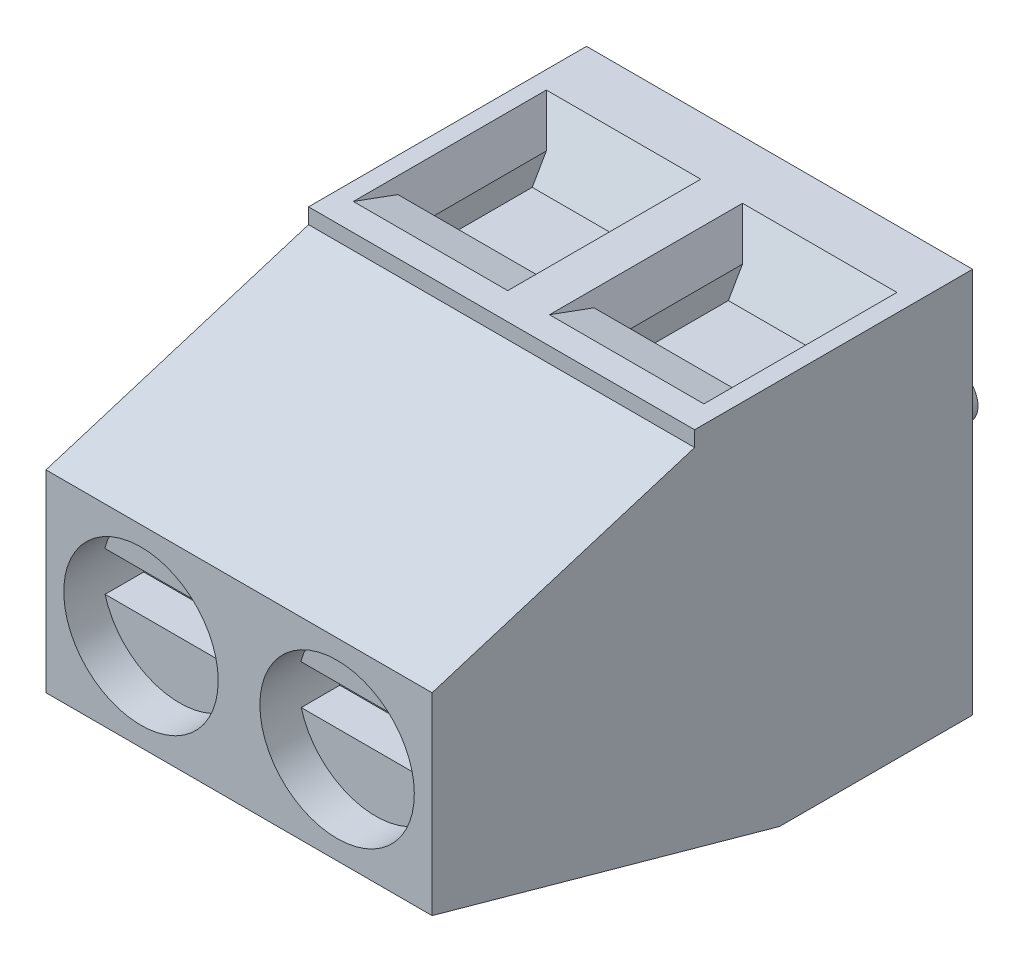
from build123d import *
from build123d.topology import SkipClean

# Parameters (mm, degrees)
SKETCH_1_W          = 10
SKETCH_1_H          = 10
EXTRUDE_1_DEPTH     = 14
CUT_EXTRUDE_1_DEPTH = 20.899748742
SKETCH_3_W          = 3
SKETCH_3_H          = 3
CUT_EXTRUDE_2_DEPTH = 1.5
CHAMFER_1_SIZE      = 1
CHAMFER_1_SIZE2     = 0.267949192
CHAMFER_2_SIZE      = 1
CHAMFER_2_SIZE_2    = 1.732050808
CHAMFER_3_SIZE      = 0.5
CHAMFER_3_SIZE_2    = 0.866025404
SKETCH_4_W          = 2
SKETCH_4_H          = 4.5
CUT_EXTRUDE_3_DEPTH = 1.5
SKETCH_5_R          = 2
CUT_EXTRUDE_4_DEPTH = 1
CUT_EXTRUDE_5_DEPTH = 1
SKETCH_7_R          = 0.6
EXTRUDE_2_DEPTH     = 2


with BuildPart() as part:
    # 草图1 → 凸台-拉伸1 (new body)
    with BuildSketch(Plane.XY):
        with Locations((5, 5)):
            Rectangle(SKETCH_1_W, SKETCH_1_H)
    extrude(amount=EXTRUDE_1_DEPTH)

    # 草图2 → 切除-拉伸1 (cut, through all)
    with BuildSketch(Plane(origin=(10, 0, 0), x_dir=(0, 0, -1), z_dir=(1, 0, 0))):
        Polygon((-14, 2.5), (-14, 0), (-5, 0), align=None)
        Polygon((-14, 7.5), (-14, 10), (-7.2, 10), (-7.2, 9.6), align=None)
    extrude(amount=-CUT_EXTRUDE_1_DEPTH, mode=Mode.SUBTRACT)

    # 草图3 → 切除-拉伸2 (cut)
    with BuildSketch(Plane(origin=(0, 10, 0), x_dir=(1, 0, 0), z_dir=(0, 1, 0))):
        with Locations((2.46, -4)):
            Rectangle(SKETCH_3_W, SKETCH_3_H)
        with Locations((7.54, -4)):
            Rectangle(SKETCH_3_W, SKETCH_3_H)
    extrude(amount=-CUT_EXTRUDE_2_DEPTH, mode=Mode.SUBTRACT)

    # 倒角1
    chamfer_1_edges = [part.edges().sort_by_distance(p)[0] for p in [
        (2.46, 10, 5.5),
        (7.54, 10, 5.5),
    ]]
    chamfer_1_side = [part.faces().sort_by_distance(p)[0] for p in [
        (5, 10, 3.466666667),
    ]]
    chamfer(chamfer_1_edges, length=CHAMFER_1_SIZE, length2=CHAMFER_1_SIZE2, reference=chamfer_1_side[0])

    # 倒角2
    # the kernel refuses this chamfer: 1.732050808, 1 mm, written as the material it takes off along each edge
    with BuildSketch(Plane(origin=(0.96, 10, 2.5), x_dir=(0, 0.057893862402671484, -0.9983227437537926), z_dir=(1, 0, 0))) as chamfer_2_piece_1_section:
        Polygon((CHAMFER_2_SIZE * 0.998322743754, -CHAMFER_2_SIZE * 0.0578938624027), (-CHAMFER_2_SIZE_2 * 0.0578938623883, -CHAMFER_2_SIZE_2 * 0.998322743505), (0, 0), align=None)
    chamfer_2_piece_1 = extrude(amount=3, mode=Mode.PRIVATE)
    chamfer_2_piece_1 = split(chamfer_2_piece_1, bisect_by=Plane(origin=(2.46, 8.5, 2.161390478), z_dir=(0, 1, 0)), keep=Keep.TOP, mode=Mode.PRIVATE)
    add(chamfer_2_piece_1, mode=Mode.SUBTRACT)
    with BuildSketch(Plane(origin=(-3.520963971, 10, 2.5), x_dir=(0, 0.057893862402671484, -0.9983227437537926), z_dir=(1, 0, 0))) as chamfer_2_piece_2_section:
        Polygon((CHAMFER_2_SIZE * 0.998322743754, -CHAMFER_2_SIZE * 0.0578938624027), (-CHAMFER_2_SIZE_2 * 0.0578938623883, -CHAMFER_2_SIZE_2 * 0.998322743505), (0, 0), align=None)
    chamfer_2_piece_2 = extrude(amount=11.961927941, mode=Mode.PRIVATE)
    chamfer_2_piece_2 = split(chamfer_2_piece_2, bisect_by=Plane(origin=(7.240481985, 8.5, 2.161390478), z_dir=(0, 1, 0)), keep=Keep.TOP, mode=Mode.PRIVATE)
    chamfer_2_piece_2 = split(chamfer_2_piece_2, bisect_by=Plane(origin=(6.04, 9.440926985, 2.161390478), z_dir=(1, 0, 0)), keep=Keep.TOP, mode=Mode.PRIVATE)
    add(chamfer_2_piece_2, mode=Mode.SUBTRACT)
    with BuildSketch(Plane(origin=(1.559036029, 10, 2.5), x_dir=(0, 0.05789386240267147, -0.9983227437537926), z_dir=(1, 0, 0))) as chamfer_2_piece_3_section:
        Polygon((CHAMFER_2_SIZE * 0.998322743754, -CHAMFER_2_SIZE * 0.0578938624027), (-CHAMFER_2_SIZE_2 * 0.0578938623883, -CHAMFER_2_SIZE_2 * 0.998322743505), (0, 0), align=None)
    chamfer_2_piece_3 = extrude(amount=11.961927941, mode=Mode.PRIVATE)
    chamfer_2_piece_3 = split(chamfer_2_piece_3, bisect_by=Plane(origin=(2.759518015, 8.5, 2.161390478), z_dir=(0, 1, 0)), keep=Keep.TOP, mode=Mode.PRIVATE)
    chamfer_2_piece_3 = split(chamfer_2_piece_3, bisect_by=Plane(origin=(3.96, 9.440926985, 2.161390478), z_dir=(-1, 0, 0)), keep=Keep.TOP, mode=Mode.PRIVATE)
    add(chamfer_2_piece_3, mode=Mode.SUBTRACT)
    with BuildSketch(Plane(origin=(6.04, 10, 2.5), x_dir=(0, 0.057893862402671484, -0.9983227437537926), z_dir=(1, 0, 0))) as chamfer_2_piece_4_section:
        Polygon((CHAMFER_2_SIZE * 0.998322743754, -CHAMFER_2_SIZE * 0.0578938624027), (-CHAMFER_2_SIZE_2 * 0.0578938623883, -CHAMFER_2_SIZE_2 * 0.998322743505), (0, 0), align=None)
    chamfer_2_piece_4 = extrude(amount=3, mode=Mode.PRIVATE)
    chamfer_2_piece_4 = split(chamfer_2_piece_4, bisect_by=Plane(origin=(7.54, 8.5, 2.161390478), z_dir=(0, 1, 0)), keep=Keep.TOP, mode=Mode.PRIVATE)
    add(chamfer_2_piece_4, mode=Mode.SUBTRACT)

    # 倒角3
    # the kernel refuses this chamfer: 0.866025404, 0.5 mm, written as the material it takes off along each edge
    with BuildSketch(Plane(origin=(0.96, 10, 8.740481985), x_dir=(-0.9983227437537926, 0.057893862402669756, 3.38732848352391e-15), z_dir=(0, 0, -1))) as chamfer_3_piece_1_section:
        Polygon((CHAMFER_3_SIZE * 0.998322743754, -CHAMFER_3_SIZE * 0.0578938624027), (-CHAMFER_3_SIZE_2 * 0.0578938623883, -CHAMFER_3_SIZE_2 * 0.998322743505), (0, 0), align=None)
    chamfer_3_piece_1 = extrude(amount=9.480963971, mode=Mode.PRIVATE)
    chamfer_3_piece_1 = split(chamfer_3_piece_1, bisect_by=Plane(origin=(0.892667554, 9.405329997, 5.5), z_dir=(0, 0, -1)), keep=Keep.TOP, mode=Mode.PRIVATE)
    chamfer_3_piece_1 = split(chamfer_3_piece_1, bisect_by=Plane(origin=(0.892667554, 9.55774733, 4.849490567), z_dir=(0, -0.9659258262890682, 0.25881904510252124)), keep=Keep.TOP, mode=Mode.PRIVATE)
    add(chamfer_3_piece_1, mode=Mode.SUBTRACT)
    with BuildSketch(Plane(origin=(0.96, 10, 8.740481985), x_dir=(-0.9983227437537926, 0.057893862402669756, 3.38732848352391e-15), z_dir=(0, 0, -1))) as chamfer_3_piece_2_section:
        Polygon((CHAMFER_3_SIZE * 0.998322743754, -CHAMFER_3_SIZE * 0.0578938624027), (-CHAMFER_3_SIZE_2 * 0.0578938623883, -CHAMFER_3_SIZE_2 * 0.998322743505), (0, 0), align=None)
    chamfer_3_piece_2 = extrude(amount=9.480963971, mode=Mode.PRIVATE)
    chamfer_3_piece_2 = split(chamfer_3_piece_2, bisect_by=Plane(origin=(0.727363304, 9.931547557, 5.5), z_dir=(0, 0, 1)), keep=Keep.TOP, mode=Mode.PRIVATE)
    chamfer_3_piece_2 = split(chamfer_3_piece_2, bisect_by=Plane(origin=(0.727363304, 9.838481056, 5.897203096), z_dir=(0, 0.9659258262890682, -0.25881904510252124)), keep=Keep.TOP, mode=Mode.PRIVATE)
    add(chamfer_3_piece_2, mode=Mode.SUBTRACT)
    with BuildSketch(Plane(origin=(0.96, 10, 8.740481985), x_dir=(-0.9983227437537926, 0.057893862402669756, 3.38732848352391e-15), z_dir=(0, 0, -1))) as chamfer_3_piece_3_section:
        Polygon((CHAMFER_3_SIZE * 0.998322743754, -CHAMFER_3_SIZE * 0.0578938624027), (-CHAMFER_3_SIZE_2 * 0.0578938623883, -CHAMFER_3_SIZE_2 * 0.998322743505), (0, 0), align=None)
    chamfer_3_piece_3 = extrude(amount=9.480963971, mode=Mode.PRIVATE)
    chamfer_3_piece_3 = split(chamfer_3_piece_3, bisect_by=Plane(origin=(0.786656387, 9.751906355, 5.5), z_dir=(0, 0, -1)), keep=Keep.TOP, mode=Mode.PRIVATE)
    chamfer_3_piece_3 = split(chamfer_3_piece_3, bisect_by=Plane(origin=(0.786656387, 8.975998219, 2.091207704), z_dir=(0, 0.4999999999999566, 0.8660254037844637)), keep=Keep.TOP, mode=Mode.PRIVATE)
    chamfer_3_piece_3 = split(chamfer_3_piece_3, bisect_by=Plane(origin=(0.786656387, 9.217160881, 3.578404635), z_dir=(0, 0.9659258262890682, -0.25881904510252124)), keep=Keep.TOP, mode=Mode.PRIVATE)
    add(chamfer_3_piece_3, mode=Mode.SUBTRACT)
    with BuildSketch(Plane(origin=(3.96, 10, -0.740481985), x_dir=(0.9983227437537926, 0.057893862402669756, 3.38732848352391e-15), z_dir=(0, 0, 1))) as chamfer_3_piece_4_section:
        Polygon((CHAMFER_3_SIZE * 0.998322743754, -CHAMFER_3_SIZE * 0.0578938624027), (-CHAMFER_3_SIZE_2 * 0.0578938623883, -CHAMFER_3_SIZE_2 * 0.998322743505), (0, 0), align=None)
    chamfer_3_piece_4 = extrude(amount=9.480963971, mode=Mode.PRIVATE)
    chamfer_3_piece_4 = split(chamfer_3_piece_4, bisect_by=Plane(origin=(4.133343613, 9.751906355, 5.5), z_dir=(0, 0, -1)), keep=Keep.TOP, mode=Mode.PRIVATE)
    chamfer_3_piece_4 = split(chamfer_3_piece_4, bisect_by=Plane(origin=(4.133343613, 8.975998219, 2.091207704), z_dir=(0, 0.4999999999999566, 0.8660254037844637)), keep=Keep.TOP, mode=Mode.PRIVATE)
    chamfer_3_piece_4 = split(chamfer_3_piece_4, bisect_by=Plane(origin=(4.133343613, 9.217160881, 3.578404635), z_dir=(0, 0.9659258262890682, -0.25881904510252124)), keep=Keep.TOP, mode=Mode.PRIVATE)
    add(chamfer_3_piece_4, mode=Mode.SUBTRACT)
    with BuildSketch(Plane(origin=(3.96, 10, -0.740481985), x_dir=(0.9983227437537926, 0.057893862402669756, 3.38732848352391e-15), z_dir=(0, 0, 1))) as chamfer_3_piece_5_section:
        Polygon((CHAMFER_3_SIZE * 0.998322743754, -CHAMFER_3_SIZE * 0.0578938624027), (-CHAMFER_3_SIZE_2 * 0.0578938623883, -CHAMFER_3_SIZE_2 * 0.998322743505), (0, 0), align=None)
    chamfer_3_piece_5 = extrude(amount=9.480963971, mode=Mode.PRIVATE)
    chamfer_3_piece_5 = split(chamfer_3_piece_5, bisect_by=Plane(origin=(4.027332446, 9.405329997, 5.5), z_dir=(0, 0, -1)), keep=Keep.TOP, mode=Mode.PRIVATE)
    chamfer_3_piece_5 = split(chamfer_3_piece_5, bisect_by=Plane(origin=(4.027332446, 9.55774733, 4.849490567), z_dir=(0, -0.9659258262890682, 0.25881904510252124)), keep=Keep.TOP, mode=Mode.PRIVATE)
    add(chamfer_3_piece_5, mode=Mode.SUBTRACT)
    with BuildSketch(Plane(origin=(3.96, 10, -0.740481985), x_dir=(0.9983227437537926, 0.057893862402669756, 3.38732848352391e-15), z_dir=(0, 0, 1))) as chamfer_3_piece_6_section:
        Polygon((CHAMFER_3_SIZE * 0.998322743754, -CHAMFER_3_SIZE * 0.0578938624027), (-CHAMFER_3_SIZE_2 * 0.0578938623883, -CHAMFER_3_SIZE_2 * 0.998322743505), (0, 0), align=None)
    chamfer_3_piece_6 = extrude(amount=9.480963971, mode=Mode.PRIVATE)
    chamfer_3_piece_6 = split(chamfer_3_piece_6, bisect_by=Plane(origin=(4.192636696, 9.931547557, 5.5), z_dir=(0, 0, 1)), keep=Keep.TOP, mode=Mode.PRIVATE)
    chamfer_3_piece_6 = split(chamfer_3_piece_6, bisect_by=Plane(origin=(4.192636696, 9.838481056, 5.897203096), z_dir=(0, 0.9659258262890682, -0.25881904510252124)), keep=Keep.TOP, mode=Mode.PRIVATE)
    add(chamfer_3_piece_6, mode=Mode.SUBTRACT)
    with BuildSketch(Plane(origin=(6.04, 10, 8.740481985), x_dir=(-0.9983227437537926, 0.057893862402669756, 3.455429323526044e-15), z_dir=(0, 0, -1))) as chamfer_3_piece_7_section:
        Polygon((CHAMFER_3_SIZE * 0.998322743754, -CHAMFER_3_SIZE * 0.0578938624027), (-CHAMFER_3_SIZE_2 * 0.0578938623883, -CHAMFER_3_SIZE_2 * 0.998322743505), (0, 0), align=None)
    chamfer_3_piece_7 = extrude(amount=9.480963971, mode=Mode.PRIVATE)
    chamfer_3_piece_7 = split(chamfer_3_piece_7, bisect_by=Plane(origin=(5.972667554, 9.55774733, 4.849490567), z_dir=(0, -0.9659258262890682, 0.25881904510252124)), keep=Keep.TOP, mode=Mode.PRIVATE)
    chamfer_3_piece_7 = split(chamfer_3_piece_7, bisect_by=Plane(origin=(5.972667554, 9.405329997, 5.5), z_dir=(0, 0, -1)), keep=Keep.TOP, mode=Mode.PRIVATE)
    add(chamfer_3_piece_7, mode=Mode.SUBTRACT)
    with BuildSketch(Plane(origin=(6.04, 10, 8.740481985), x_dir=(-0.9983227437537926, 0.057893862402669756, 3.455429323526044e-15), z_dir=(0, 0, -1))) as chamfer_3_piece_8_section:
        Polygon((CHAMFER_3_SIZE * 0.998322743754, -CHAMFER_3_SIZE * 0.0578938624027), (-CHAMFER_3_SIZE_2 * 0.0578938623883, -CHAMFER_3_SIZE_2 * 0.998322743505), (0, 0), align=None)
    chamfer_3_piece_8 = extrude(amount=9.480963971, mode=Mode.PRIVATE)
    chamfer_3_piece_8 = split(chamfer_3_piece_8, bisect_by=Plane(origin=(5.807363304, 9.838481056, 5.897203096), z_dir=(0, 0.9659258262890682, -0.25881904510252124)), keep=Keep.TOP, mode=Mode.PRIVATE)
    chamfer_3_piece_8 = split(chamfer_3_piece_8, bisect_by=Plane(origin=(5.807363304, 9.931547557, 5.5), z_dir=(0, 0, 1)), keep=Keep.TOP, mode=Mode.PRIVATE)
    add(chamfer_3_piece_8, mode=Mode.SUBTRACT)
    with BuildSketch(Plane(origin=(6.04, 10, 8.740481985), x_dir=(-0.9983227437537926, 0.057893862402669756, 3.455429323526044e-15), z_dir=(0, 0, -1))) as chamfer_3_piece_9_section:
        Polygon((CHAMFER_3_SIZE * 0.998322743754, -CHAMFER_3_SIZE * 0.0578938624027), (-CHAMFER_3_SIZE_2 * 0.0578938623883, -CHAMFER_3_SIZE_2 * 0.998322743505), (0, 0), align=None)
    chamfer_3_piece_9 = extrude(amount=9.480963971, mode=Mode.PRIVATE)
    chamfer_3_piece_9 = split(chamfer_3_piece_9, bisect_by=Plane(origin=(5.866656387, 9.217160881, 3.578404635), z_dir=(0, 0.9659258262890682, -0.25881904510252124)), keep=Keep.TOP, mode=Mode.PRIVATE)
    chamfer_3_piece_9 = split(chamfer_3_piece_9, bisect_by=Plane(origin=(5.866656387, 9.751906355, 5.5), z_dir=(0, 0, -1)), keep=Keep.TOP, mode=Mode.PRIVATE)
    chamfer_3_piece_9 = split(chamfer_3_piece_9, bisect_by=Plane(origin=(5.866656387, 8.975998219, 2.091207704), z_dir=(0, 0.4999999999999566, 0.8660254037844637)), keep=Keep.TOP, mode=Mode.PRIVATE)
    add(chamfer_3_piece_9, mode=Mode.SUBTRACT)
    with BuildSketch(Plane(origin=(9.04, 10, -0.740481985), x_dir=(0.9983227437537927, 0.05789386240266987, 3.455429323526051e-15), z_dir=(0, 0, 1))) as chamfer_3_piece_10_section:
        Polygon((CHAMFER_3_SIZE * 0.998322743754, -CHAMFER_3_SIZE * 0.0578938624027), (-CHAMFER_3_SIZE_2 * 0.0578938623883, -CHAMFER_3_SIZE_2 * 0.998322743505), (0, 0), align=None)
    chamfer_3_piece_10 = extrude(amount=9.480963971, mode=Mode.PRIVATE)
    chamfer_3_piece_10 = split(chamfer_3_piece_10, bisect_by=Plane(origin=(9.213343613, 9.751906355, 5.5), z_dir=(0, 0, -1)), keep=Keep.TOP, mode=Mode.PRIVATE)
    chamfer_3_piece_10 = split(chamfer_3_piece_10, bisect_by=Plane(origin=(9.213343613, 8.975998219, 2.091207704), z_dir=(0, 0.4999999999999566, 0.8660254037844637)), keep=Keep.TOP, mode=Mode.PRIVATE)
    chamfer_3_piece_10 = split(chamfer_3_piece_10, bisect_by=Plane(origin=(9.213343613, 9.217160881, 3.578404635), z_dir=(0, 0.9659258262890682, -0.25881904510252124)), keep=Keep.TOP, mode=Mode.PRIVATE)
    add(chamfer_3_piece_10, mode=Mode.SUBTRACT)
    with BuildSketch(Plane(origin=(9.04, 10, -0.740481985), x_dir=(0.9983227437537927, 0.05789386240266987, 3.455429323526051e-15), z_dir=(0, 0, 1))) as chamfer_3_piece_11_section:
        Polygon((CHAMFER_3_SIZE * 0.998322743754, -CHAMFER_3_SIZE * 0.0578938624027), (-CHAMFER_3_SIZE_2 * 0.0578938623883, -CHAMFER_3_SIZE_2 * 0.998322743505), (0, 0), align=None)
    chamfer_3_piece_11 = extrude(amount=9.480963971, mode=Mode.PRIVATE)
    chamfer_3_piece_11 = split(chamfer_3_piece_11, bisect_by=Plane(origin=(9.107332446, 9.405329997, 5.5), z_dir=(0, 0, -1)), keep=Keep.TOP, mode=Mode.PRIVATE)
    chamfer_3_piece_11 = split(chamfer_3_piece_11, bisect_by=Plane(origin=(9.107332446, 9.55774733, 4.849490567), z_dir=(0, -0.9659258262890682, 0.25881904510252124)), keep=Keep.TOP, mode=Mode.PRIVATE)
    add(chamfer_3_piece_11, mode=Mode.SUBTRACT)
    with BuildSketch(Plane(origin=(9.04, 10, -0.740481985), x_dir=(0.9983227437537927, 0.05789386240266987, 3.455429323526051e-15), z_dir=(0, 0, 1))) as chamfer_3_piece_12_section:
        Polygon((CHAMFER_3_SIZE * 0.998322743754, -CHAMFER_3_SIZE * 0.0578938624027), (-CHAMFER_3_SIZE_2 * 0.0578938623883, -CHAMFER_3_SIZE_2 * 0.998322743505), (0, 0), align=None)
    chamfer_3_piece_12 = extrude(amount=9.480963971, mode=Mode.PRIVATE)
    chamfer_3_piece_12 = split(chamfer_3_piece_12, bisect_by=Plane(origin=(9.272636696, 9.931547557, 5.5), z_dir=(0, 0, 1)), keep=Keep.TOP, mode=Mode.PRIVATE)
    chamfer_3_piece_12 = split(chamfer_3_piece_12, bisect_by=Plane(origin=(9.272636696, 9.838481056, 5.897203096), z_dir=(0, 0.9659258262890682, -0.25881904510252124)), keep=Keep.TOP, mode=Mode.PRIVATE)
    add(chamfer_3_piece_12, mode=Mode.SUBTRACT)

    # 草图4 → 切除-拉伸3 (cut)
    with BuildSketch(Plane.XZ):
        with Locations((7.54, 4.75)):
            Rectangle(SKETCH_4_W, SKETCH_4_H)
        with Locations((2.46, 4.75)):
            Rectangle(SKETCH_4_W, SKETCH_4_H)
    extrude(amount=-CUT_EXTRUDE_3_DEPTH, mode=Mode.SUBTRACT)

    # 草图5 → 切除-拉伸4 (cut)
    with BuildSketch(Plane.XY.offset(14)):
        with Locations((2.46, 5)):
            Circle(SKETCH_5_R)
        with Locations(Location((7.54, 5, 0), (0, 0, 180))):
            Circle(SKETCH_5_R)
    extrude(amount=-CUT_EXTRUDE_4_DEPTH, mode=Mode.SUBTRACT)

    # 草图6 → 切除-拉伸5 (cut)
    with SkipClean():  # the faces are left unmerged after this step: merging them gives an invalid solid
        with BuildSketch(Plane.XY.offset(13)):
            with BuildLine():
                Line((0.523508327, 5.5), (4.396491673, 5.5))
                ThreePointArc((4.396491673, 5.5), (4.459953667, 4.986386343), (4.389505556, 4.473684211))
                Line((4.389505556, 4.473684211), (0.530494444, 4.473684211))
                ThreePointArc((0.530494444, 4.473684211), (0.460046333, 4.986386343), (0.523508327, 5.5))
            make_face()
            with BuildLine():
                Line((9.469505556, 4.473684211), (5.610494444, 4.473684211))
                ThreePointArc((5.610494444, 4.473684211), (5.540046333, 4.986386343), (5.603508327, 5.5))
                Line((5.603508327, 5.5), (9.476491673, 5.5))
                ThreePointArc((9.476491673, 5.5), (9.539953667, 4.986386343), (9.469505556, 4.473684211))
            make_face()
        extrude(amount=-CUT_EXTRUDE_5_DEPTH, mode=Mode.SUBTRACT)

    # 草图7 → 凸台-拉伸2 (add)
    with SkipClean():  # the faces are left unmerged after this step: merging them gives an invalid solid
        with BuildSketch(Plane(origin=(0, 0, 0), x_dir=(-1, 0, 0), z_dir=(0, 0, -1))):
            with Locations(Location((-7.54, 5, 0), (0, 0, 180))):
                Circle(SKETCH_7_R)
            with Locations(Location((-2.46, 5, 0), (0, 0, 180))):
                Circle(SKETCH_7_R)
        extrude(amount=EXTRUDE_2_DEPTH)


solid = part.part
